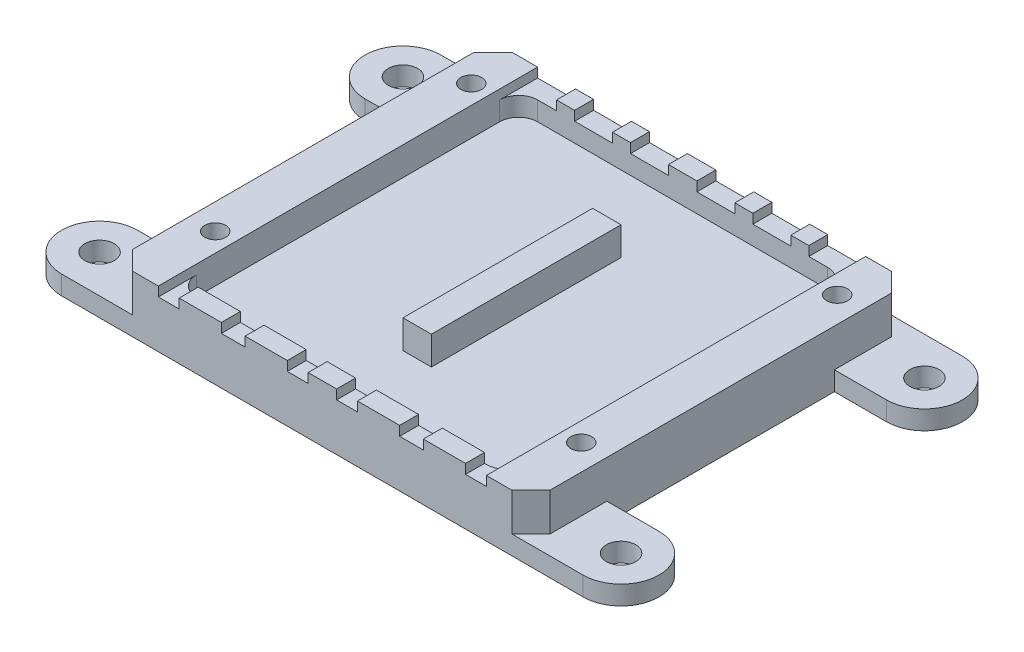
from build123d import *

# Parameters (mm, degrees)
SKETCH_1_R          = 1.55
EXTRUDE_1_DEPTH     = 2
SKETCH_2_W          = 44
SKETCH_2_H          = 40
EXTRUDE_2_DEPTH     = 4
SKETCH_3_W          = 34.6
SKETCH_3_H          = 36
SKETCH_3_W_2        = 3
SKETCH_3_H_2        = 20
CUT_EXTRUDE_1_DEPTH = 3
SKETCH_4_W          = 2.2
SKETCH_4_H          = 2
SKETCH_4_W_2        = 4
SKETCH_4_W_3        = 2.5
CUT_EXTRUDE_2_DEPTH = 1
FILLET_2_R          = 2
SKETCH_5_R          = 1.1
CUT_EXTRUDE_3_DEPTH = 38.792194961
SKETCH_6_R          = 2
CUT_EXTRUDE_4_DEPTH = 2.5
CHAMFER3_SIZE       = 2


with BuildPart() as part:
    # 草图1 → 凸台-拉伸1 (new body)
    with BuildSketch(Plane(origin=(0, 0, 0), x_dir=(1, 0, 0), z_dir=(0, 1, 0))):
        with BuildLine():
            Line((27.5, -20), (22, -20))
            Line((22, -20), (16, -20))
            Line((16, -20), (-16, -20))
            Line((-16, -20), (-22, -20))
            Line((-22, -20), (-27.5, -20))
            ThreePointArc((-27.5, -20), (-31.5, -16), (-27.5, -12))
            Line((-27.5, -12), (-22, -12))
            Line((-22, -12), (-22, 12))
            Line((-22, 12), (-27.5, 12))
            ThreePointArc((-27.5, 12), (-31.5, 16), (-27.5, 20))
            Line((-27.5, 20), (-22, 20))
            Line((-22, 20), (-16, 20))
            Line((-16, 20), (16, 20))
            Line((16, 20), (22, 20))
            Line((22, 20), (27.5, 20))
            ThreePointArc((27.5, 20), (31.5, 16), (27.5, 12))
            Line((27.5, 12), (22, 12))
            Line((22, 12), (22, -12))
            Line((22, -12), (27.5, -12))
            ThreePointArc((27.5, -12), (31.5, -16), (27.5, -20))
        make_face()
        with Locations((-27.5, -16)):
            Circle(SKETCH_1_R, mode=Mode.SUBTRACT)
        with Locations((-27.5, 16)):
            Circle(SKETCH_1_R, mode=Mode.SUBTRACT)
        with Locations((27.5, 16)):
            Circle(SKETCH_1_R, mode=Mode.SUBTRACT)
        with Locations((27.5, -16)):
            Circle(SKETCH_1_R, mode=Mode.SUBTRACT)
    extrude(amount=EXTRUDE_1_DEPTH)

    # 草图2 → 凸台-拉伸2 (add)
    with BuildSketch(Plane(origin=(0, 2, 0), x_dir=(1, 0, 0), z_dir=(0, 1, 0))):
        Rectangle(SKETCH_2_W, SKETCH_2_H)
    extrude(amount=EXTRUDE_2_DEPTH)

    # 草图3 → 切除-拉伸1 (cut)
    with BuildSketch(Plane(origin=(0, 6, 0), x_dir=(1, 0, 0), z_dir=(0, 1, 0))):
        Rectangle(SKETCH_3_W, SKETCH_3_H)
        Rectangle(SKETCH_3_W_2, SKETCH_3_H_2, mode=Mode.SUBTRACT)
    extrude(amount=-CUT_EXTRUDE_1_DEPTH, mode=Mode.SUBTRACT)

    # 草图4 → 切除-拉伸2 (cut)
    with BuildSketch(Plane(origin=(0, 6, 0), x_dir=(1, 0, 0), z_dir=(0, 1, 0))):
        with Locations((16.2, -19)):
            Rectangle(SKETCH_4_W, SKETCH_4_H)
        with Locations((-15.3, 19)):
            Rectangle(SKETCH_4_W_2, SKETCH_4_H)
        with Locations((15.3, 19)):
            Rectangle(SKETCH_4_W_2, SKETCH_4_H)
        with Locations((-16.2, -19)):
            Rectangle(SKETCH_4_W, SKETCH_4_H)
        with Locations((-3.5, 19)):
            Rectangle(SKETCH_4_W_2, SKETCH_4_H)
        with Locations((3.5, 19)):
            Rectangle(SKETCH_4_W_2, SKETCH_4_H)
        with Locations((2.6, -19)):
            Rectangle(SKETCH_4_W, SKETCH_4_H)
        with Locations((9.4, 19)):
            Rectangle(SKETCH_4_W_2, SKETCH_4_H)
        with Locations((-9.4, 19)):
            Rectangle(SKETCH_4_W_2, SKETCH_4_H)
        with Locations((-2.6, -19)):
            Rectangle(SKETCH_4_W, SKETCH_4_H)
        with Locations((-9.4, -19)):
            Rectangle(SKETCH_4_W_3, SKETCH_4_H)
        with Locations((9.4, -19)):
            Rectangle(SKETCH_4_W_3, SKETCH_4_H)
    extrude(amount=-CUT_EXTRUDE_2_DEPTH, mode=Mode.SUBTRACT)

    # 圆角2
    fillet_2_edges = [part.edges().sort_by_distance(p)[0] for p in [
        (17.3, 4, -18),
        (-17.3, 4, -18),
        (-17.3, 4, 18),
        (17.3, 4, 18),
    ]]
    fillet(fillet_2_edges, radius=FILLET_2_R)

    # 草图5 → 切除-拉伸3 (cut, through all)
    with BuildSketch(Plane(origin=(0, 6, 0), x_dir=(1, 0, 0), z_dir=(0, 1, 0))):
        with Locations((19.3, 15)):
            Circle(SKETCH_5_R)
        with Locations((19.3, -12)):
            Circle(SKETCH_5_R)
        with Locations((-19.3, -12)):
            Circle(SKETCH_5_R)
        with Locations((-19.3, 15)):
            Circle(SKETCH_5_R)
    extrude(amount=-CUT_EXTRUDE_3_DEPTH, mode=Mode.SUBTRACT)

    # 草图6 → 切除-拉伸4 (cut)
    with BuildSketch(Plane.XZ):
        with Locations((19.3, 12)):
            Circle(SKETCH_6_R)
        with Locations((-19.3, 12)):
            Circle(SKETCH_6_R)
        with Locations((-19.3, -15)):
            Circle(SKETCH_6_R)
        with Locations((19.3, -15)):
            Circle(SKETCH_6_R)
    extrude(amount=-CUT_EXTRUDE_4_DEPTH, mode=Mode.SUBTRACT)

    # Chamfer3
    chamfer3_edges = [part.edges().sort_by_distance(p)[0] for p in [
        (22, 4, 20),
        (-22, 4, 20),
        (-22, 4, -20),
        (22, 4, -20),
    ]]
    chamfer(chamfer3_edges, length=CHAMFER3_SIZE)


solid = part.part
